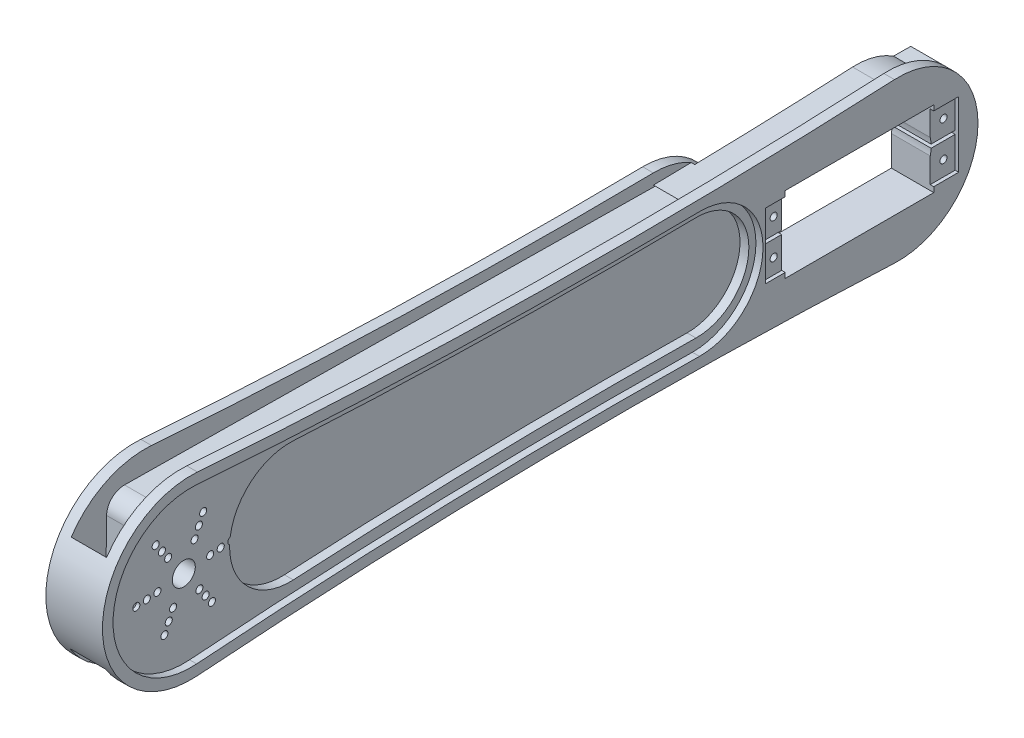
from build123d import *

# Parameters (mm, degrees)
SKETCH1_R                = 3.25
BOSS_EXTRUDE1_DEPTH      = 16
CUT_EXTRUDE1_START       = -2
SKETCH3_R                = 3.25
CUT_EXTRUDE1_DEPTH       = 2
CUT_EXTRUDE3_START       = -16
CUT_EXTRUDE3_DEPTH       = 1.5
SKETCH15_W               = 10
SKETCH15_H               = 197.059334101
CUT_EXTRUDE9_DEPTH       = 6
CUT_EXTRUDE10_DEPTH      = 226.832977272
CUT_EXTRUDE10_DEPTH_BACK = 226.832977272
SKETCH17_W               = 10
SKETCH17_H               = 10
CUT_EXTRUDE11_DEPTH      = 228.139798975
FILLET8_R                = 5
BOSS_EXTRUDE2_REACH      = 226.471
CUT_EXTRUDE13_DEPTH      = 12
CUT_EXTRUDE15_DEPTH      = 4.5
CUT_EXTRUDE16_START      = -4.5
CUT_EXTRUDE16_DEPTH      = 4.5
SKETCH26_R               = 1
CUT_EXTRUDE17_DEPTH      = 6
CUT_EXTRUDE18_DEPTH      = 225.471044903
CUT_EXTRUDE18_DEPTH_BACK = 1
SKETCH26_3_W             = 54.6
SKETCH26_3_H             = 18.537240037
CUT_EXTRUDE19_DEPTH      = 4
CUT_EXTRUDE20_DEPTH      = 223.947993965
CUT_EXTRUDE20_DEPTH_BACK = 223.947993965
SKETCH29_W               = 5
SKETCH29_H               = 5.952588684
FILLET9_R                = 5
SKETCH32_R               = 1
CUT_EXTRUDE21_DEPTH      = 6


with BuildPart() as part:
    # Sketch1 → Boss-Extrude1 (new body)
    with BuildSketch(Plane(origin=(0, 0, 0), x_dir=(0, 0, -1), z_dir=(1, 0, 0))):
        with BuildLine():
            ThreePointArc((1.850721154, 24.931402512), (-25, 0), (1.850721154, -24.931402512))
            ThreePointArc((1.850721154, -24.931402512), (100.334833268, -20.665694092), (198.894717835, -22.472835854))
            ThreePointArc((198.894717835, -22.472835854), (222.5, 0), (198.894717835, 22.472835854))
            ThreePointArc((198.894717835, 22.472835854), (100.334833268, 20.665694092), (1.850721154, 24.931402512))
        make_face()
        Circle(SKETCH1_R, mode=Mode.SUBTRACT)
        with Locations(Location((200, 0, 0), (0, 0, 180))):
            Circle(SKETCH1_R, mode=Mode.SUBTRACT)
    extrude(amount=BOSS_EXTRUDE1_DEPTH)

    # Sketch3 → Cut-Extrude1 (cut)
    with BuildSketch(Plane(origin=(16, 0, 0), x_dir=(0, 0, -1), z_dir=(1, 0, 0)).offset(CUT_EXTRUDE1_START)):
        with BuildLine():
            ThreePointArc((1.628634615, -21.93963421), (100.29740444, -17.665927587), (199.04208879, -19.47645774))
            ThreePointArc((199.04208879, -19.47645774), (219.5, 0), (199.04208879, 19.47645774))
            ThreePointArc((199.04208879, 19.47645774), (100.29740444, 17.665927587), (1.628634615, 21.93963421))
            ThreePointArc((1.628634615, 21.93963421), (-22, 0), (1.628634615, -21.93963421))
        make_face()
        Circle(SKETCH3_R, mode=Mode.SUBTRACT)
        with BuildLine():
            ThreePointArc((30.948830257, -17.028479538), (12.945106443, 0), (30.948830257, 17.028479538))
            ThreePointArc((30.948830257, 17.028479538), (87.841768176, 14.86913386), (144.77549423, 14.727725417))
            ThreePointArc((144.77549423, 14.727725417), (159.729436473, 0), (144.77549423, -14.727725417))
            ThreePointArc((144.77549423, -14.727725417), (87.841768176, -14.86913386), (30.948830257, -17.028479538))
        make_face(mode=Mode.SUBTRACT)
        with Locations(Location((200, 0, 0), (0, 0, 180))):
            Circle(SKETCH3_R, mode=Mode.SUBTRACT)
    extrude(amount=CUT_EXTRUDE1_DEPTH, mode=Mode.SUBTRACT)

    # Sketch3<2> → Cut-Extrude3 (cut)
    with BuildSketch(Plane(origin=(16, 0, 0), x_dir=(0, 0, -1), z_dir=(1, 0, 0)).offset(CUT_EXTRUDE3_START)):
        with BuildLine():
            ThreePointArc((1.628634615, -21.93963421), (100.29740444, -17.665927587), (199.04208879, -19.47645774))
            ThreePointArc((199.04208879, -19.47645774), (219.5, 0), (199.04208879, 19.47645774))
            ThreePointArc((199.04208879, 19.47645774), (100.29740444, 17.665927587), (1.628634615, 21.93963421))
            ThreePointArc((1.628634615, 21.93963421), (-22, 0), (1.628634615, -21.93963421))
        make_face()
        with BuildLine():
            ThreePointArc((30.948830257, -17.028479538), (12.945106443, 0), (30.948830257, 17.028479538))
            ThreePointArc((30.948830257, 17.028479538), (87.841768176, 14.86913386), (144.77549423, 14.727725417))
            ThreePointArc((144.77549423, 14.727725417), (159.729436473, 0), (144.77549423, -14.727725417))
            ThreePointArc((144.77549423, -14.727725417), (87.841768176, -14.86913386), (30.948830257, -17.028479538))
        make_face(mode=Mode.SUBTRACT)
    extrude(amount=CUT_EXTRUDE3_DEPTH, mode=Mode.SUBTRACT)

    # Sketch15 → Cut-Extrude9 (cut)
    with BuildSketch(Plane(origin=(0, 24.998046799, -0.3125), x_dir=(1, 0, 0), z_dir=(0, 0.9999218719480037, -0.012500000000000532))):
        with Locations((8, 100.068601079)):
            Rectangle(SKETCH15_W, SKETCH15_H)
    cut_extrude9 = extrude(amount=-CUT_EXTRUDE9_DEPTH, mode=Mode.SUBTRACT)

    # Sketch16 → Cut-Extrude10 (cut, two sides: drawn at the far end of the back side and taken through both)
    with BuildSketch(Plane(origin=(0, -2.482478352, -198.582752034), x_dir=(1, 0, 0), z_dir=(0, 0.012500000000000532, 0.9999218719480037)).offset(-CUT_EXTRUDE10_DEPTH_BACK)):
        Polygon((3, 24.957264068), (3, 27.091896258), (13, 27.091896258), (13, 24.957264068), (13, 19), (3, 19), align=None)
    extrude(amount=CUT_EXTRUDE10_DEPTH + CUT_EXTRUDE10_DEPTH_BACK, mode=Mode.SUBTRACT)

    # Sketch17 → Cut-Extrude11 (cut, through all)
    with BuildSketch(Plane(origin=(0, 18.998515567, -0.2375), x_dir=(1, 0, 0), z_dir=(0, 0.9999218719480037, -0.012500000000000535))):
        with Locations((8, -16)):
            Rectangle(SKETCH17_W, SKETCH17_H)
    extrude(amount=-CUT_EXTRUDE11_DEPTH, mode=Mode.SUBTRACT)

    # Fillet8
    fillet8_edges = [part.edges().sort_by_distance(p)[0] for p in [
        (8, 19.136015567, 10.761640591),
        (8, -22.31069035, 11.279764895),
    ]]
    fillet(fillet8_edges, radius=FILLET8_R)

    # Boss-Extrude2: up to this face of the body (flat: up to its plane)
    boss_extrude2_end = Plane(part.part.faces().sort_by_distance((0, 0, -84.468195017))[0])
    # Sketch18 → Boss-Extrude2 (add, up to the picked face)
    with BuildSketch(Plane(origin=(16, 0, 0), x_dir=(0, 0, -1), z_dir=(1, 0, 0)), mode=Mode.PRIVATE) as boss_extrude2_sk1:
        with BuildLine():
            ThreePointArc((143.755477713, 17.712821261), (161.729436473, 0), (143.755477713, -17.712821261))
            ThreePointArc((143.755477713, -17.712821261), (171.406391045, -18.35614981), (199.04208879, -19.47645774))
            ThreePointArc((199.04208879, -19.47645774), (219.5, 0), (199.04208879, 19.47645774))
            ThreePointArc((199.04208879, 19.47645774), (171.406391045, 18.35614981), (143.755477713, 17.712821261))
        make_face()
    boss_extrude2_tool1 = split(extrude(boss_extrude2_sk1.sketch, amount=-BOSS_EXTRUDE2_REACH, mode=Mode.PRIVATE), bisect_by=boss_extrude2_end, keep=Keep.BOTH, mode=Mode.PRIVATE)
    add(boss_extrude2_tool1.solids().sort_by(Axis((16, 0, -187.069219), (-1, 0, 0)))[0])

    # Sketch21 → Cut-Extrude13 (cut)
    with BuildSketch(Plane(origin=(16, 0, 0), x_dir=(0, 0, -1), z_dir=(1, 0, 0))):
        with BuildLine():
            Line((168, -10.75), (210, -10.75))
            Line((210, -10.75), (210, -2.25))
            ThreePointArc((210, -2.25), (210.156659789, -1.380131127), (210.237797615, -0.5))
            Line((210.237797615, -0.5), (210.25, -0.5))
            Line((210.25, -0.5), (217.05, -0.5))
            Line((217.05, -0.5), (217.05, 0.5))
            Line((217.05, 0.5), (210.25, 0.5))
            Line((210.25, 0.5), (210.237797615, 0.5))
            ThreePointArc((210.237797615, 0.5), (210.156659789, 1.380131127), (210, 2.25))
            Line((210, 2.25), (210, 10.75))
            Line((210, 10.75), (168, 10.75))
            Line((168, 10.75), (168, 0.5))
            Line((168, 0.5), (162.45, 0.5))
            Line((162.45, 0.5), (162.45, -0.5))
            Line((162.45, -0.5), (168, -0.5))
            Line((168, -0.5), (168, -10.75))
        make_face()
    extrude(amount=-CUT_EXTRUDE13_DEPTH, mode=Mode.SUBTRACT)

    # Sketch23 → Cut-Extrude15 (cut)
    with BuildSketch(Plane.ZY):
        with BuildLine():
            ThreePointArc((-144.77549423, 14.727725417), (-159.729436473, 0), (-144.77549423, -14.727725417))
            ThreePointArc((-144.77549423, -14.727725417), (-87.841768176, -14.86913386), (-30.948830257, -17.028479538))
            ThreePointArc((-30.948830257, -17.028479538), (-12.945106443, 0), (-30.948830257, 17.028479538))
            ThreePointArc((-30.948830257, 17.028479538), (-87.841768176, 14.86913386), (-144.77549423, 14.727725417))
        make_face()
    extrude(amount=-CUT_EXTRUDE15_DEPTH, mode=Mode.SUBTRACT)

    # Sketch24 → Cut-Extrude16 (cut)
    with BuildSketch(Plane(origin=(16, 0, 0), x_dir=(0, 0, -1), z_dir=(1, 0, 0)).offset(CUT_EXTRUDE16_START)):
        with BuildLine():
            ThreePointArc((144.77549423, -14.727725417), (159.729436473, 0), (144.77549423, 14.727725417))
            ThreePointArc((144.77549423, 14.727725417), (87.841768176, 14.86913386), (30.948830257, 17.028479538))
            ThreePointArc((30.948830257, 17.028479538), (12.945106443, 0), (30.948830257, -17.028479538))
            ThreePointArc((30.948830257, -17.028479538), (87.841768176, -14.86913386), (144.77549423, -14.727725417))
        make_face()
    extrude(amount=CUT_EXTRUDE16_DEPTH, mode=Mode.SUBTRACT)

    # Sketch26 → Cut-Extrude17 (cut)
    with BuildSketch(Plane(origin=(16, 0, 0), x_dir=(0, 0, -1), z_dir=(1, 0, 0))):
        with Locations((213.75, 5)):
            Circle(SKETCH26_R)
        with Locations((213.75, -5)):
            Circle(SKETCH26_R)
        with Locations((165.75, -5)):
            Circle(SKETCH26_R)
        with Locations((165.75, 5)):
            Circle(SKETCH26_R)
    extrude(amount=-CUT_EXTRUDE17_DEPTH, mode=Mode.SUBTRACT)

    # Sketch26<3> → Cut-Extrude18 (cut, two sides: drawn at the far end of the back side and taken through both)
    with BuildSketch(Plane(origin=(16, 0, 0), x_dir=(0, 0, -1), z_dir=(1, 0, 0)).offset(-CUT_EXTRUDE18_DEPTH_BACK)):
        with Locations((189.75, -0.018620019)):
            Rectangle(SKETCH26_3_W, SKETCH26_3_H)
    extrude(amount=CUT_EXTRUDE18_DEPTH + CUT_EXTRUDE18_DEPTH_BACK, mode=Mode.SUBTRACT)

    # Sketch28 → Cut-Extrude19 (cut)
    with BuildSketch(Plane.ZY):
        with BuildLine():
            ThreePointArc((-143.71157515, 20.712500005), (-164.729436473, 0), (-143.71157515, -20.712500005))
            ThreePointArc((-143.71157515, -20.712500005), (-171.310740048, -21.35462457), (-198.894717835, -22.472835854))
            ThreePointArc((-198.894717835, -22.472835854), (-222.5, 0), (-198.894717835, 22.472835854))
            ThreePointArc((-198.894717835, 22.472835854), (-171.310740048, 21.35462457), (-143.71157515, 20.712500005))
        make_face()
    extrude(amount=-CUT_EXTRUDE19_DEPTH, mode=Mode.SUBTRACT)

    # Mirror1: Cut-Extrude9 across plane
    add(cut_extrude9.mirror(Plane.ZX), mode=Mode.SUBTRACT)

    # Sketch29 → Cut-Extrude20 (cut, two sides: drawn at the far end of the back side and taken through both)
    with BuildSketch(Plane(origin=(0, 0.019236675, -1.538813795), x_dir=(-1, 0, 0), z_dir=(0, 0.012500000000001647, -0.9999218719480037)).offset(-CUT_EXTRUDE20_DEPTH_BACK)):
        with Locations((-10.5, -21.976294342)):
            Rectangle(SKETCH29_W, SKETCH29_H)
        with Locations((-5.5, -21.976294342)):
            Rectangle(SKETCH29_W, SKETCH29_H)
        Polygon((-8, -27.230500843), (-8, -24.952588684), (-13, -24.952588684), (-13, -19), (-13.5, -19), (-13.5, -27.230500843), (-13, -27.230500843), align=None)
        Polygon((-2.5, -19), (-3, -19), (-3, -24.952588684), (-8, -24.952588684), (-8, -27.230500843), (-3, -27.230500843), (-2.5, -27.230500843), align=None)
    extrude(amount=CUT_EXTRUDE20_DEPTH + CUT_EXTRUDE20_DEPTH_BACK, mode=Mode.SUBTRACT)

    # Fillet9
    # the kernel refuses this fillet: 5 mm, written as the material it takes off along each edge
    with BuildSketch(Plane(origin=(13, -19.14194634, 11.236065358), x_dir=(0, 0.012500000000001623, -0.9999218719480037), z_dir=(-1, 0, 0))) as fillet9_piece_1:
        with BuildLine():
            CenterArc((5.122504194, -5), FILLET9_R, 90, 91.432431792)
            Line((0.124066694, -5.124990234), (-0.375777056, -5.137489257))
            ThreePointArc((-0.375777056, -5.137489257), (-0.49887675, -0.21465563), (-0.49994045, 0.007716637))
            Line((-0.49994045, 0.007716637), (0, 0.5))
            Line((0, 0.5), (5.122504194, 0.5))
            Line((5.122504194, 0.5), (5.122504194, 0))
        make_face()
    extrude(amount=10, mode=Mode.SUBTRACT)

    # Sketch32 → Cut-Extrude21 (cut)
    with BuildSketch(Plane(origin=(14, 0, 0), x_dir=(0, 0, -1), z_dir=(1, 0, 0))):
        with Locations((3.042387058, 6.855208311)):
            Circle(SKETCH32_R)
        with Locations((4.259341881, 9.597291636)):
            Circle(SKETCH32_R)
        with Locations((5.476296704, 12.33937496)):
            Circle(SKETCH32_R)
        with Locations((13.424360534, 1.427075416)):
            Circle(SKETCH32_R)
        with Locations((10.441169305, 1.109947546)):
            Circle(SKETCH32_R)
        with Locations((7.457978075, 0.792819675)):
            Circle(SKETCH32_R)
        with Locations((7.94806383, -10.912299544)):
            Circle(SKETCH32_R)
        with Locations((6.181827424, -8.48734409)):
            Circle(SKETCH32_R)
        with Locations((4.415591017, -6.062388636)):
            Circle(SKETCH32_R)
        with Locations((-5.476296704, -12.33937496)):
            Circle(SKETCH32_R)
        with Locations((-4.259341881, -9.597291636)):
            Circle(SKETCH32_R)
        with Locations((-3.042387058, -6.855208311)):
            Circle(SKETCH32_R)
        with Locations((-13.424360534, -1.427075416)):
            Circle(SKETCH32_R)
        with Locations((-10.441169305, -1.109947546)):
            Circle(SKETCH32_R)
        with Locations((-7.457978075, -0.792819675)):
            Circle(SKETCH32_R)
        with Locations((-7.94806383, 10.912299544)):
            Circle(SKETCH32_R)
        with Locations((-6.181827424, 8.48734409)):
            Circle(SKETCH32_R)
        with Locations((-4.415591017, 6.062388636)):
            Circle(SKETCH32_R)
    extrude(amount=-CUT_EXTRUDE21_DEPTH, mode=Mode.SUBTRACT)


solid = part.part
